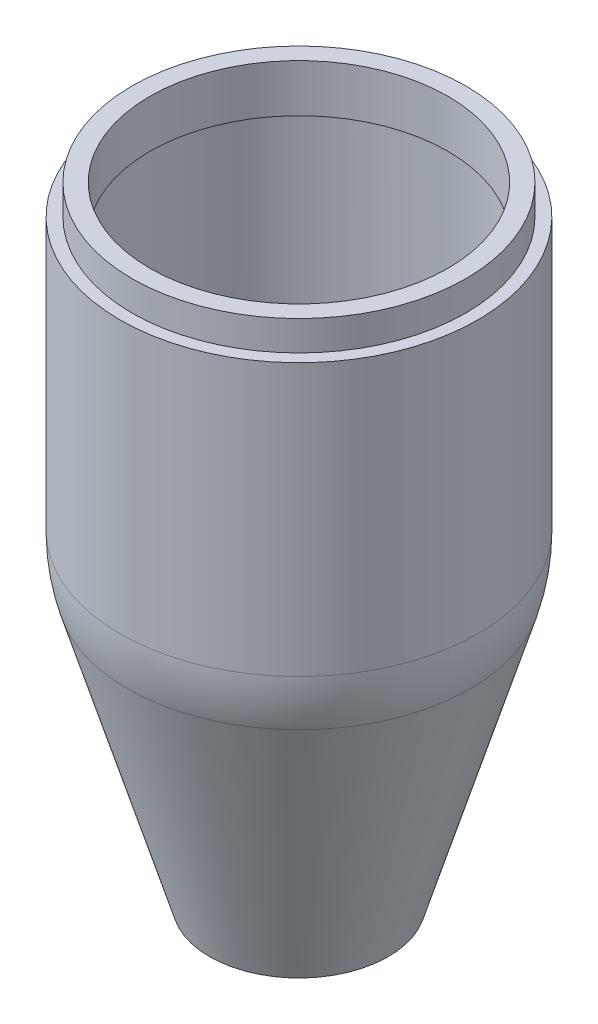
from build123d import *
from build123d.topology import SkipClean

# Parameters (mm, degrees)
SKETCH2_R           = 28
SKETCH2_R_2         = 25
EXTRUDE_THIN1_DEPTH = 5


# Read off the part's stored shape, not the designer's step: Shell2
with BuildPart() as part:
    # Sketch1 → Revolve1 (revolve)
    with BuildSketch(Plane.XY, mode=Mode.PRIVATE) as revolve1_sk:
        with BuildLine():
            Line((0, 0), (0, 100))
            Line((0, 100), (30, 100))
            Line((30, 100), (30, 54.403065089))
            ThreePointArc((30, 54.403065089), (29.682011865, 50.046670749), (28.734788557, 45.782628522))
            Line((28.734788557, 45.782628522), (15, 0))
            Line((15, 0), (0, 0))
        make_face()
    revolve(revolve1_sk.sketch.rotate(Axis((0, 126.662122273, 0), (0, -1, 0)), 90), axis=Axis((0, 126.662122273, 0), (0, -1, 0)))

    # Sketch2 → Extrude-Thin1 (add)
    with BuildSketch(Plane(origin=(0, 100, 0), x_dir=(-1, 0, 0), z_dir=(0, 1, 0))):
        Circle(SKETCH2_R)
        Circle(SKETCH2_R_2, mode=Mode.SUBTRACT)
    extrude(amount=EXTRUDE_THIN1_DEPTH)

    # Shell2 outline → Shell2 (revolve, cut)
    with SkipClean():  # the faces are left unmerged after this step: merging them gives an invalid solid
        with BuildSketch(Plane.XY):
            with BuildLine():
                Line((25, 97), (25, 100))
                Line((25, 100), (0, 100))
                Line((0, 100), (0, 0))
                Line((0, 0), (11.867908047, 0))
                Line((11.867908047, 0), (25.861309693, 46.644672153))
                ThreePointArc((25.861309693, 46.644672153), (26.713810678, 50.482310183), (27, 54.403065116))
                Line((27, 54.403065116), (27, 97))
                Line((27, 97), (25, 97))
            make_face()
        revolve(axis=Axis((0, 0, 0), (0, 1, 0)), mode=Mode.SUBTRACT)


solid = part.part
